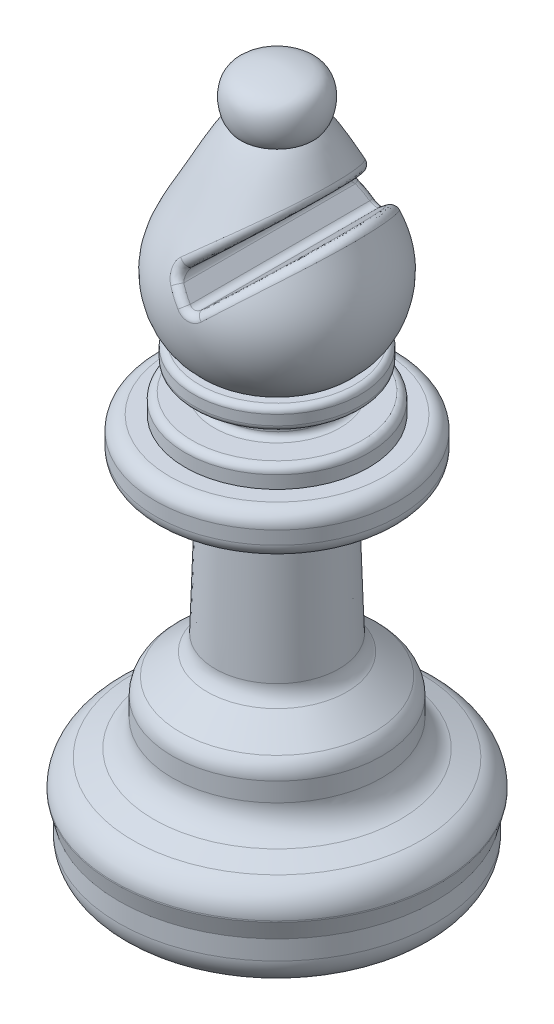
from build123d import *

# Parameters (mm, degrees)
CUT_EXTRUDE1_DEPTH      = 32
CUT_EXTRUDE1_DEPTH_BACK = 22
FILLET1_R               = 1


with BuildPart() as part:
    # Sketch2 → Revolve1 (revolve)
    with BuildSketch(Plane.XY):
        with BuildLine():
            Line((1.740575667, 4), (1.740575667, 6.702833232))
            Line((1.740575667, 6.702833232), (1.109602195, 9.178190698))
            Line((1.109602195, 9.178190698), (1.109602195, 9.350740281))
            ThreePointArc((1.109602195, 9.350740281), (1.828122406, 11.638072873), (3.72554739, 13.103658118))
            Line((3.72554739, 13.103658118), (6.668286573, 14.188923633))
            ThreePointArc((6.668286573, 14.188923633), (8.565711557, 15.654508878), (9.284231767, 17.94184147))
            Line((9.284231767, 17.94184147), (9.284231767, 20.599501634))
            ThreePointArc((9.284231767, 20.599501634), (9.579407101, 21.897162424), (10.406847451, 22.939464909))
            Line((10.406847451, 22.939464909), (14.183893998, 25.969840652))
            ThreePointArc((14.183893998, 25.969840652), (14.990735861, 26.970054019), (15.30504591, 28.21609967))
            Line((15.30504591, 28.21609967), (15.955268452, 49.023221015))
            Line((15.955268452, 49.023221015), (8.889548863, 49.023221015))
            ThreePointArc((8.889548863, 49.023221015), (7.4753353, 49.609007453), (6.889548863, 51.023221015))
            Line((6.889548863, 51.023221015), (6.889548863, 52.881072435))
            ThreePointArc((6.889548863, 52.881072435), (7.4753353, 54.295285997), (8.889548863, 54.881072435))
            Line((8.889548863, 54.881072435), (11.07891649, 54.881072435))
            Line((11.07891649, 54.881072435), (11.07891649, 56.655848396))
            ThreePointArc((11.07891649, 56.655848396), (11.371809709, 57.362955177), (12.07891649, 57.655848396))
            Line((12.07891649, 57.655848396), (15.155268452, 57.655848396))
            ThreePointArc((15.155268452, 57.655848396), (15.720953877, 57.890162971), (15.955268452, 58.455848396))
            Line((15.955268452, 58.455848396), (15.955268452, 60.174698075))
            ThreePointArc((15.955268452, 60.174698075), (15.720953877, 60.7403835), (15.155268452, 60.974698075))
            Line((15.155268452, 60.974698075), (13.073054808, 60.974698075))
            ThreePointArc((13.073054808, 60.974698075), (12.507369383, 61.20901265), (12.273054808, 61.774698075))
            Line((12.273054808, 61.774698075), (12.273054808, 63.167103524))
            ThreePointArc((12.273054808, 63.167103524), (12.507369383, 63.732788949), (13.073054808, 63.967103524))
            Line((13.073054808, 63.967103524), (14.11416163, 63.967103524))
            add(Edge.make_bspline(
                [(14.11416163, 63.967103524), (11.268800033, 66.211132993), (8.76690109, 73.437608239), (14.215755475, 82.503866847), (17.318125861, 89.002798136), (18.89338343, 90.801787939)],
                knots=[0, 0, 0, 0, 0.347089639, 0.628002877, 1, 1, 1, 1], degree=3))
            add(Edge.make_bspline(
                [(18.89338343, 90.801787939), (17.885590294, 92.123215073), (17.616867428, 96.079249154), (20.335078893, 96.914108945), (22.275496908, 97.338662484), (23.242405956, 97.422964139), (24.009146911, 97.420404062)],
                knots=[0, 0, 0, 0, 0.50933973, 0.690883889, 0.739949916, 1, 1, 1, 1], degree=3))
            Line((24.009146911, 97.420404062), (24.009146911, 0))
            Line((24.009146911, 0), (5.740575667, 0))
            ThreePointArc((5.740575667, 0), (2.912148542, 1.171572875), (1.740575667, 4))
        make_face()
    revolve(axis=Axis((24.009146911, 0, 0), (0, 1, 0)))

    # Sketch4 → Cut-Extrude1 (cut, two sides: drawn at the far end of the back side and taken through both)
    with BuildSketch(Plane.XY.offset(-CUT_EXTRUDE1_DEPTH_BACK)):
        Polygon((37.00150053, 90.55557453), (22.283492518, 77.153811137), (25.095765853, 74.065332384), (39.813773866, 87.467095777), align=None)
    extrude(amount=CUT_EXTRUDE1_DEPTH + CUT_EXTRUDE1_DEPTH_BACK, mode=Mode.SUBTRACT)

    # Fillet1
    fillet1_edges = [part.edges().sort_by_distance(p)[0] for p in [
        (32.091178186, 86.084386705, 0),
        (34.115787019, 82.27868499, 0),
        (22.283492518, 77.153811137, 0),
        (23.663243774, 75.638548597, -13.286208082),
        (25.095765853, 74.065332384, 0),
        (23.663243774, 75.638548597, 13.286208082),
    ]]
    fillet(fillet1_edges, radius=FILLET1_R)


solid = part.part
